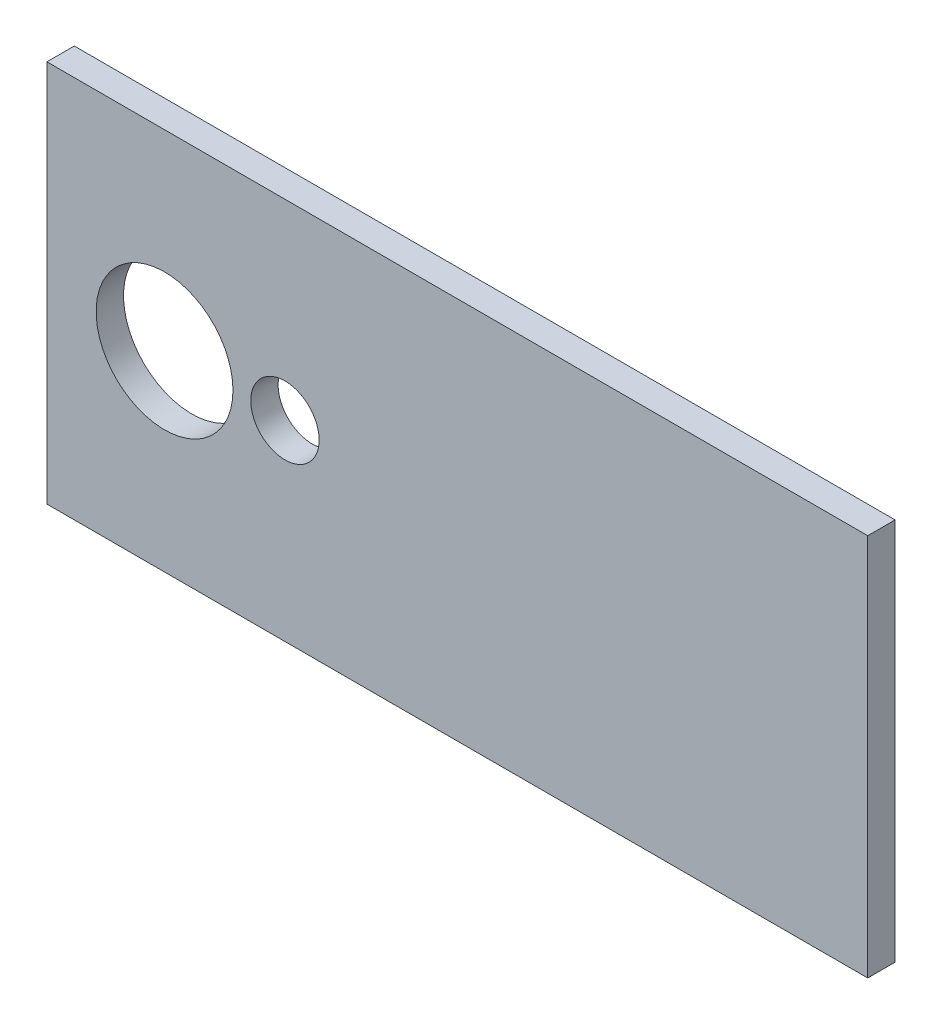
from build123d import *

# Parameters (mm, degrees)
SKETCH1_W           = 190.5
SKETCH1_H           = 88.9
SKETCH1_R           = 15.875
SKETCH1_R_2         = 7.9375
BOSS_EXTRUDE1_DEPTH = 3.175


with BuildPart() as part:
    # Sketch1 → Boss-Extrude1 (new, symmetric)
    with BuildSketch(Plane.XY):
        Rectangle(SKETCH1_W, SKETCH1_H)
        with Locations((-67.945, 0)):
            Circle(SKETCH1_R, mode=Mode.SUBTRACT)
        with Locations((-40.005, 0)):
            Circle(SKETCH1_R_2, mode=Mode.SUBTRACT)
    extrude(amount=BOSS_EXTRUDE1_DEPTH, both=True)


solid = part.part
